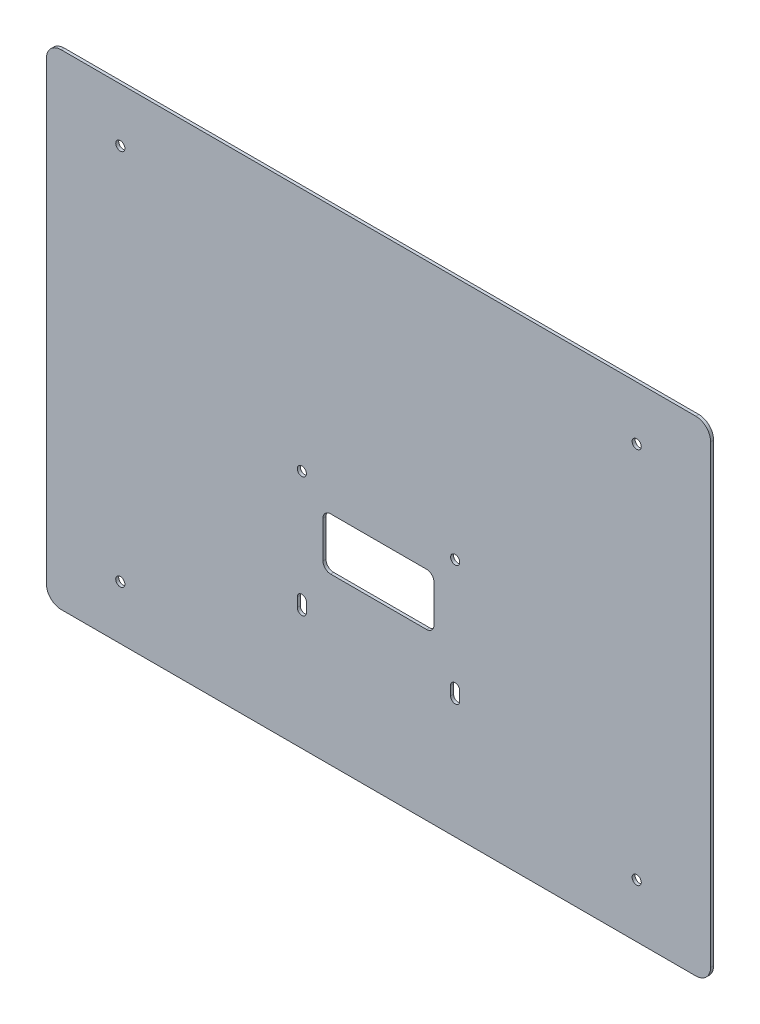
from build123d import *

# Parameters (mm, degrees)
SKETCH2_W               = 450.48
SKETCH2_H               = 328.82
BOSS_EXTRUDE1_DEPTH     = 2.032
CUT_EXTRUDE1_DEPTH      = 279.868848608
CUT_EXTRUDE1_DEPTH_BACK = 279.868848608
SKETCH3_R               = 3.1
FILLET1_R               = 10
CUT_EXTRUDE6_DEPTH      = 279.868848608
SKETCH9_R               = 3.1
CUT_EXTRUDE7_DEPTH      = 279.868848608


with BuildPart() as part:
    # Sketch2 → Boss-Extrude1 (new body)
    with BuildSketch(Plane.XY):
        Rectangle(SKETCH2_W, SKETCH2_H)
    extrude(amount=BOSS_EXTRUDE1_DEPTH)

    # Sketch3 → Cut-Extrude1 (cut, two sides: drawn at the far end of the back side and taken through both)
    with BuildSketch(Plane.XY.offset(2.032).offset(-CUT_EXTRUDE1_DEPTH_BACK)):
        with Locations((-175.117048267, 128.010047732)):
            Circle(SKETCH3_R)
        with Locations((175.116951733, 128.010047732)):
            Circle(SKETCH3_R)
        with Locations((-175.117051477, -128.009951732)):
            Circle(SKETCH3_R)
        with Locations((175.116948523, -128.009951732)):
            Circle(SKETCH3_R)
    extrude(amount=CUT_EXTRUDE1_DEPTH + CUT_EXTRUDE1_DEPTH_BACK, mode=Mode.SUBTRACT)

    # Fillet1
    fillet1_edges = [part.edges().sort_by_distance(p)[0] for p in [
        (-225.24, -164.41, 1.016),
        (225.24, -164.41, 1.016),
        (225.24, 164.41, 1.016),
        (-225.24, 164.41, 1.016),
    ]]
    fillet(fillet1_edges, radius=FILLET1_R)

    # Sketch8 → Cut-Extrude6 (cut, through all)
    with BuildSketch(Plane.XY.offset(2.032)):
        with BuildLine():
            Line((-37.67605638, -47.009952268), (-37.67605638, -22.009952268))
            ThreePointArc((-37.67605638, -22.009952268), (-36.160038703, -18.349961833), (-32.500048267, -16.833944156))
            Line((-32.500048267, -16.833944156), (32.499951733, -16.833944156))
            ThreePointArc((32.499951733, -16.833944156), (36.159942169, -18.349961833), (37.675959845, -22.009952268))
            Line((37.675959845, -22.009952268), (37.675959845, -47.009952268))
            ThreePointArc((37.675959845, -47.009952268), (36.159942169, -50.669942704), (32.499951733, -52.185960381))
            Line((32.499951733, -52.185960381), (-32.500048267, -52.185960381))
            ThreePointArc((-32.500048267, -52.185960381), (-36.160038703, -50.669942704), (-37.67605638, -47.009952268))
        make_face()
    extrude(amount=-CUT_EXTRUDE6_DEPTH, mode=Mode.SUBTRACT)

    # Sketch9 → Cut-Extrude7 (cut, through all)
    with BuildSketch(Plane.XY.offset(2.032)):
        with Locations((-51.997892774, -1.512107761)):
            Circle(SKETCH9_R)
        with Locations((51.99779624, -1.512107761)):
            Circle(SKETCH9_R)
        with BuildLine():
            Line((-48.897892774, -76.907796776), (-48.897892774, -83.107796776))
            ThreePointArc((-48.897892774, -83.107796776), (-51.997892774, -86.207796776), (-55.097892774, -83.107796776))
            Line((-55.097892774, -83.107796776), (-55.097892774, -76.907796776))
            ThreePointArc((-55.097892774, -76.907796776), (-51.997892774, -73.807796776), (-48.897892774, -76.907796776))
        make_face()
        with BuildLine():
            Line((55.09779624, -76.907796776), (55.09779624, -83.107796776))
            ThreePointArc((55.09779624, -83.107796776), (51.99779624, -86.207796776), (48.89779624, -83.107796776))
            Line((48.89779624, -83.107796776), (48.89779624, -76.907796776))
            ThreePointArc((48.89779624, -76.907796776), (51.99779624, -73.807796776), (55.09779624, -76.907796776))
        make_face()
    extrude(amount=-CUT_EXTRUDE7_DEPTH, mode=Mode.SUBTRACT)


solid = part.part
